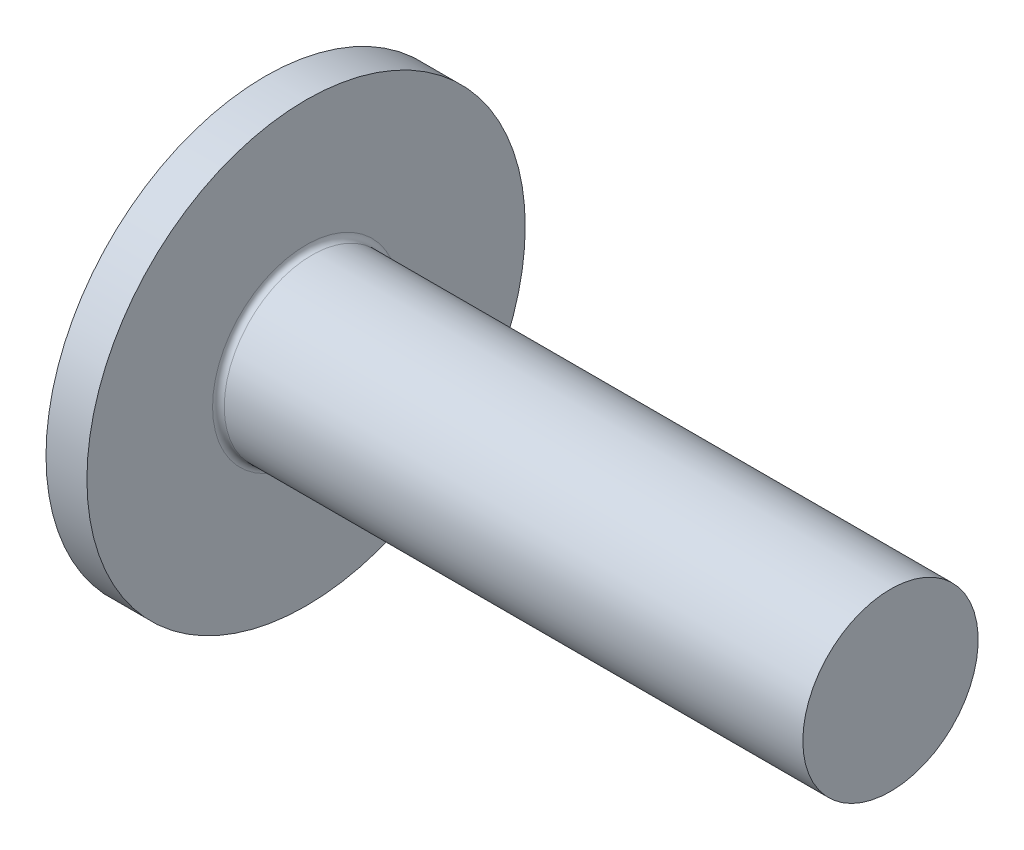
from build123d import *

# Parameters (mm, degrees)
RECPAT_COUNT = 2
RECPAT_ANGLE = 90


with BuildPart() as part:
    # Fillet1: read off the stored shape, not the designer's step
    # Fillet1 outline → Fillet1 (revolve)
    with BuildSketch(Plane.YX):
        with BuildLine():
            Line((1.5, 2.45), (1.5, 12.35))
            Line((1.5, 12.35), (0, 12.35))
            Line((0, 12.35), (0, 1.65))
            Line((0, 1.65), (3.75, 1.65))
            Line((3.75, 1.65), (3.75, 2.35))
            Line((3.75, 2.35), (1.6, 2.35))
            ThreePointArc((1.6, 2.35), (1.529289322, 2.379289322), (1.5, 2.45))
        make_face()
    revolve(axis=Axis((0, 0, 0), (1, 0, 0)))

    # PanSke → Pan (revolve)
    with BuildSketch(Plane.XY, mode=Mode.PRIVATE) as pan_sk:
        with BuildLine():
            Line((1.65, 3.133289007), (1.65, 0))
            Line((1.65, 0), (0, 0))
            ThreePointArc((0, 0), (0.437709114, 1.770593121), (1.65, 3.133289007))
        make_face()
    revolve(pan_sk.sketch.rotate(Axis((0, 0, 0), (1, 0, 0)), 90), axis=Axis((0, 0, 0), (1, 0, 0)))

    # Sketch3 → Recess section 0
    with BuildSketch(Plane(origin=(0, 0, 0), x_dir=(0, 0, -1), z_dir=(1, 0, 0))):
        with BuildLine():
            Line((-0.37, 1.45), (0.37, 1.45))
            Line((0.37, 1.45), (0.37, -1.45))
            Line((0.37, -1.45), (-0.37, -1.45))
            Line((-0.37, -1.45), (-0.37, 1.45))
        make_face()
    # Sketch4 → Recess section 1
    with BuildSketch(Plane(origin=(1.83, 0, 0), x_dir=(0, 0, -1), z_dir=(1, 0, 0))):
        with BuildLine():
            Line((-0.37, 2.106524682), (0.37, 2.106524682))
            Line((0.37, 2.106524682), (0.37, -2.106524682))
            Line((0.37, -2.106524682), (-0.37, -2.106524682))
            Line((-0.37, -2.106524682), (-0.37, 2.106524682))
        make_face()
    recess = loft(mode=Mode.SUBTRACT)

    # RecPat: Recess ×2 about axis
    recpat_axis = Axis((0, 0, 0), (1, 0, 0))
    for i in range(1, RECPAT_COUNT):
        add(recess.rotate(recpat_axis, i * RECPAT_ANGLE / (RECPAT_COUNT - 1)), mode=Mode.SUBTRACT)

    # RecCorSke → RecessCore (revolve, cut)
    with BuildSketch(Plane.XY, mode=Mode.PRIVATE) as recesscore_sk:
        Polygon((0, 0), (0, 0.877663335), (4.6, 0.556), (4.780655351, 0), align=None)
    revolve(recesscore_sk.sketch.rotate(Axis((-3.175, 0, 0), (1, 0, 0)), 90), axis=Axis((-3.175, 0, 0), (1, 0, 0)), mode=Mode.SUBTRACT)


solid = part.part
